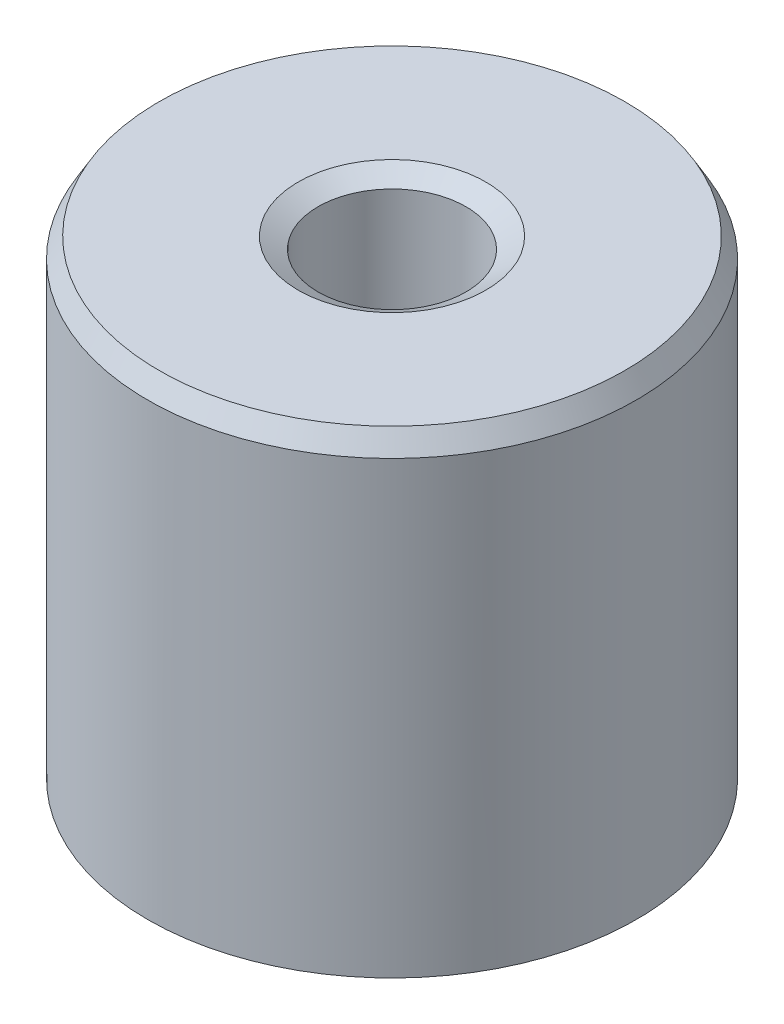
from build123d import *
from OCP.BRepFilletAPI import BRepFilletAPI_MakeChamfer

# Parameters (mm, degrees)
SKETCH1_R           = 7.5
BOSS_EXTRUDE1_DEPTH = 14.770556794
SKETCH2_R           = 2.269737108
CUT_EXTRUDE1_DEPTH  = 19.184315989
CHAMFER1_SIZE       = 0.609155142
CHAMFER1_SIZE2      = 0.351695885


with BuildPart() as part:
    # Sketch1 → Boss-Extrude1 (new body)
    with BuildSketch(Plane(origin=(0, 0, 0), x_dir=(1, 0, 0), z_dir=(0, 1, 0))):
        Circle(SKETCH1_R)
    extrude(amount=BOSS_EXTRUDE1_DEPTH)

    # Sketch2 → Cut-Extrude1 (cut, through all)
    with BuildSketch(Plane(origin=(0, 0, 0), x_dir=(1, 0, 0), z_dir=(0, 1, 0))):
        Circle(SKETCH2_R)
    extrude(amount=CUT_EXTRUDE1_DEPTH, mode=Mode.SUBTRACT)

    # Chamfer1: one chamfer whose edges measure the first distance from different faces: ONE call of the kernel's chamfer builder (chamfer() names one face for all edges)
    chamfer1_edges_1 = [part.edges().sort_by_distance(p)[0] for p in [
        (-2.269737108, 14.770556794, 0),
    ]]
    chamfer1_side_1 = [part.faces().sort_by_distance(p)[0] for p in [
        (-7.287867966, 14.770556794, 0),
    ]]
    chamfer1_edges_2 = [part.edges().sort_by_distance(p)[0] for p in [
        (-2.269737108, 0, 0),
    ]]
    chamfer1_side_2 = [part.faces().sort_by_distance(p)[0] for p in [
        (-2.269737108, 7.385278397, 0),
    ]]
    chamfer1_edges_3 = [part.edges().sort_by_distance(p)[0] for p in [
        (-7.5, 0, 0),
    ]]
    chamfer1_side_3 = [part.faces().sort_by_distance(p)[0] for p in [
        (-7.287867966, 0, 0),
    ]]
    chamfer1_edges_4 = [part.edges().sort_by_distance(p)[0] for p in [
        (-7.5, 14.770556794, 0),
    ]]
    chamfer1_side_4 = [part.faces().sort_by_distance(p)[0] for p in [
        (-7.5, 7.385278397, 0),
    ]]
    chamfer1 = BRepFilletAPI_MakeChamfer(part.part.solid().wrapped)
    for e in chamfer1_edges_1:
        chamfer1.Add(CHAMFER1_SIZE, CHAMFER1_SIZE2, e.wrapped, chamfer1_side_1[0].wrapped)  # the first distance lies on this face
    for e in chamfer1_edges_2:
        chamfer1.Add(CHAMFER1_SIZE, CHAMFER1_SIZE2, e.wrapped, chamfer1_side_2[0].wrapped)  # the first distance lies on this face
    for e in chamfer1_edges_3:
        chamfer1.Add(CHAMFER1_SIZE, CHAMFER1_SIZE2, e.wrapped, chamfer1_side_3[0].wrapped)  # the first distance lies on this face
    for e in chamfer1_edges_4:
        chamfer1.Add(CHAMFER1_SIZE, CHAMFER1_SIZE2, e.wrapped, chamfer1_side_4[0].wrapped)  # the first distance lies on this face
    add(Compound.cast(chamfer1.Shape()), mode=Mode.REPLACE)


solid = part.part
